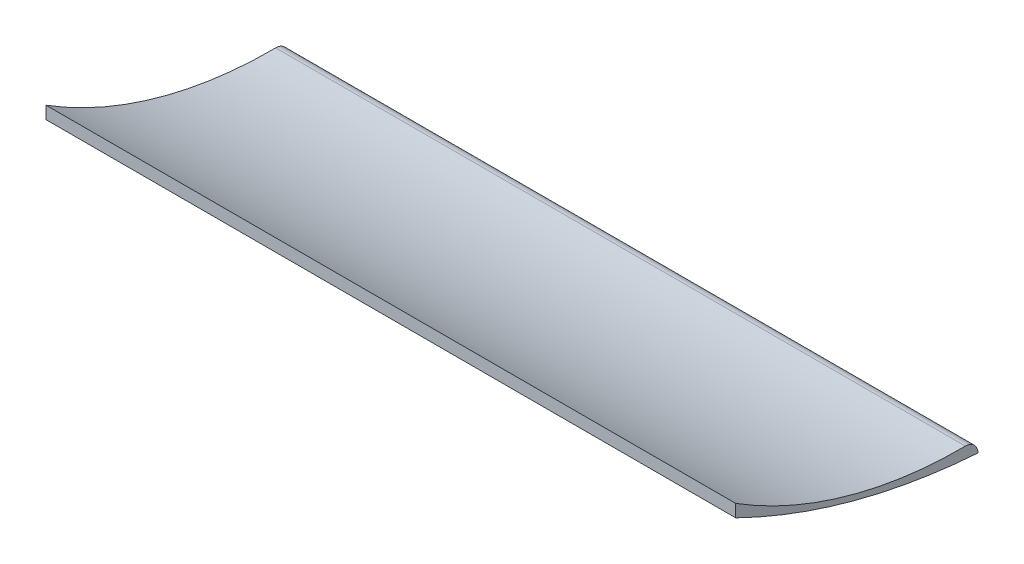
from build123d import *

# Parameters (mm, degrees)
BOSS_EXTRUDE1_DEPTH = 550
FILLET1_R           = 10


with BuildPart() as part:
    # Sketch1 → Boss-Extrude1 (new body)
    with BuildSketch(Plane(origin=(0, 0, 0), x_dir=(0, 0, -1), z_dir=(1, 0, 0))):
        with BuildLine():
            Line((193.185165258, -51.763809021), (193.185165258, -41.763809021))
            ThreePointArc((193.185165258, -41.763809021), (92.700341785, -30.407945096), (0, 10))
            Line((0, 10), (0, 0))
            ThreePointArc((0, 0), (94.080493489, -35.257148814), (193.185165258, -51.763809021))
        make_face()
    extrude(amount=BOSS_EXTRUDE1_DEPTH)

    # Fillet1
    # the kernel refuses this fillet: 10 mm, written as the material it takes off along each edge
    with BuildSketch(Plane(origin=(-25.177740899, -41.763809021, -193.185165258), x_dir=(0, -1, 0), z_dir=(1, 0, 0))) as fillet1_piece_1:
        with BuildLine():
            CenterArc((10.22050642, -9.99756855), FILLET1_R, 91.263511131, 89.143911064)
            Line((0.220759241, -10.068676539), (0.020764297, -10.070098698))
            ThreePointArc((0.020764297, -10.070098698), (-0.052289908, -5.037904855), (-0.199865085, -0.007344911))
            Line((-0.199865085, -0.007344911), (0, 0.2))
            ThreePointArc((0, 0.2), (5, 0.2), (9.995589872, 0.199951371))
            Line((9.995589872, 0.199951371), (10, 0))
        make_face()
    extrude(amount=600.355481797, mode=Mode.SUBTRACT)


solid = part.part
